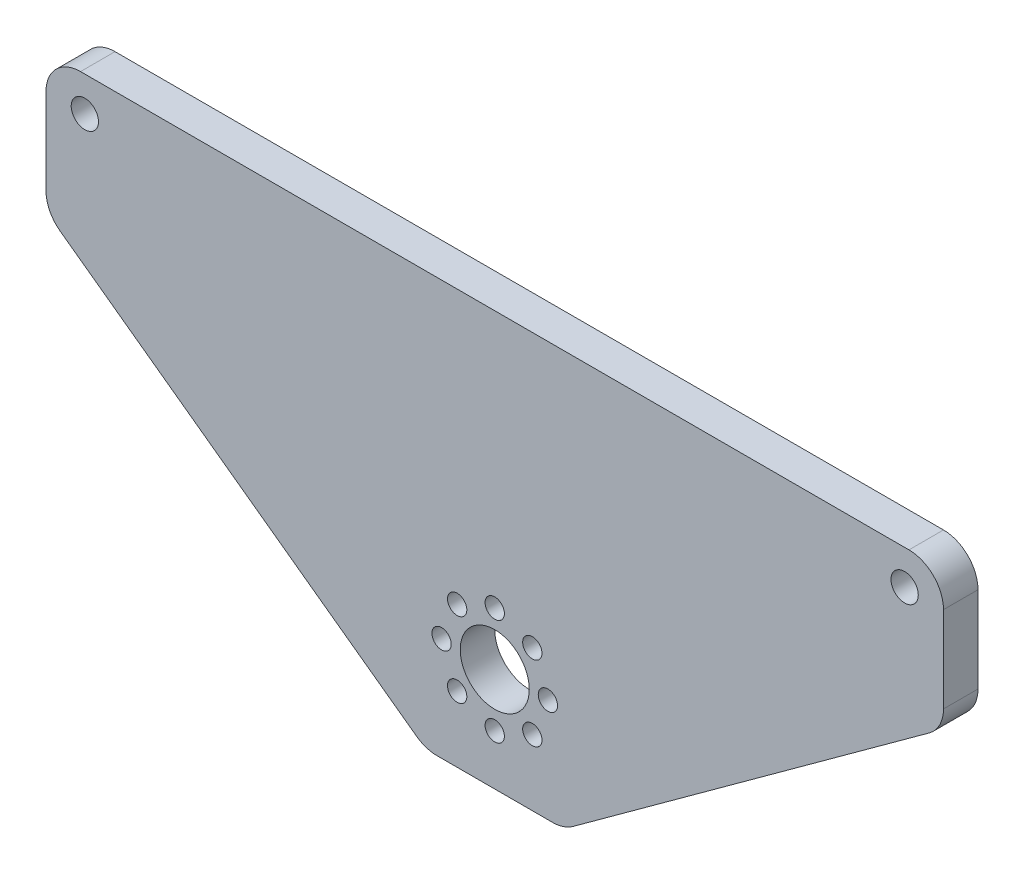
from build123d import *

# Parameters (mm, degrees)
SKETCH1_W           = 165.1
SKETCH1_H           = 76.2
SKETCH1_R           = 6.35
SKETCH1_R_2         = 2.50825
BOSS_EXTRUDE1_DEPTH = 6.35
CUT_EXTRUDE1_DEPTH  = 6.35
FILLET1_R           = 6.35
SKETCH3_R           = 1.778
CUT_EXTRUDE2_DEPTH  = 6.35
CIRPATTERN1_COUNT   = 8


with BuildPart() as part:
    # Sketch1 → Boss-Extrude1 (new body)
    with BuildSketch(Plane.XY):
        Rectangle(SKETCH1_W, SKETCH1_H)
        with Locations((0, -19.05)):
            Circle(SKETCH1_R, mode=Mode.SUBTRACT)
        with Locations((-75.40625, 31.75)):
            Circle(SKETCH1_R_2, mode=Mode.SUBTRACT)
        with Locations((75.40625, 31.75)):
            Circle(SKETCH1_R_2, mode=Mode.SUBTRACT)
    extrude(amount=BOSS_EXTRUDE1_DEPTH)

    # Sketch2 → Cut-Extrude1 (cut)
    with BuildSketch(Plane(origin=(0, 0, 0), x_dir=(-1, 0, 0), z_dir=(0, 0, -1))):
        Polygon((12.7, -38.1), (82.55, 12.7), (82.55, -38.1), align=None)
        Polygon((-82.55, -38.1), (-82.55, 12.7), (-12.7, -38.1), align=None)
    extrude(amount=-CUT_EXTRUDE1_DEPTH, mode=Mode.SUBTRACT)

    # Fillet1
    fillet1_edges = [part.edges().sort_by_distance(p)[0] for p in [
        (-82.55, 38.1, 3.175),
        (82.55, 12.7, 3.175),
        (-82.55, 12.7, 3.175),
        (-12.7, -38.1, 3.175),
        (12.7, -38.1, 3.175),
        (82.55, 38.1, 3.175),
    ]]
    fillet(fillet1_edges, radius=FILLET1_R)

    # Sketch3 → Cut-Extrude2 (cut)
    with BuildSketch(Plane(origin=(0, 0, 0), x_dir=(-1, 0, 0), z_dir=(0, 0, -1))):
        with Locations((0, -9.271)):
            Circle(SKETCH3_R)
    cut_extrude2 = extrude(amount=-CUT_EXTRUDE2_DEPTH, mode=Mode.SUBTRACT)

    # CirPattern1: Cut-Extrude2 ×8 about axis
    cirpattern1_axis = Axis((0, -19.05, 0), (0, 0, 1))
    for i in range(1, CIRPATTERN1_COUNT):
        add(cut_extrude2.rotate(cirpattern1_axis, i * 360 / CIRPATTERN1_COUNT), mode=Mode.SUBTRACT)


solid = part.part
